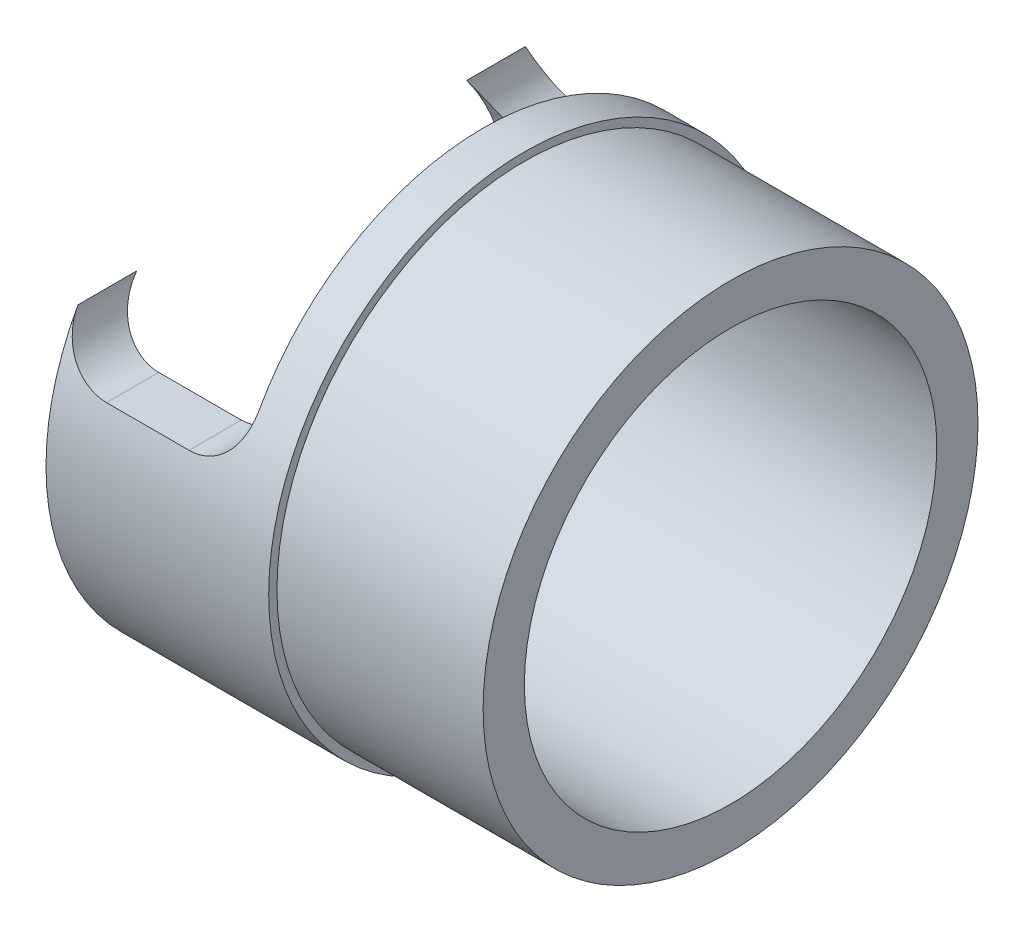
from build123d import *

# Parameters (mm, degrees)
SKETCH3_R               = 31
SKETCH3_R_2             = 25
BOSS_EXTRUDE1_DEPTH     = 22
CUT_EXTRUDE1_DEPTH      = 66.749524713
CUT_EXTRUDE1_DEPTH_BACK = 66.749524713


with BuildPart() as part:
    # Sketch1 → Revolve1 (revolve)
    with BuildSketch(Plane.XY):
        Polygon((49, 25), (19, 25), (19, 31), (24, 31), (24, 30), (49, 30), align=None)
    revolve(axis=Axis((-49, 0, 0), (1, 0, 0)))

    # Sketch3 → Boss-Extrude1 (add)
    with BuildSketch(Plane.ZY.offset(-19)):
        Circle(SKETCH3_R)
        Circle(SKETCH3_R_2, mode=Mode.SUBTRACT)
    extrude(amount=BOSS_EXTRUDE1_DEPTH)

    # Sketch4 → Cut-Extrude1 (cut, two sides: drawn at the far end of the back side and taken through both)
    with BuildSketch(Plane.XY.offset(-CUT_EXTRUDE1_DEPTH_BACK)):
        with BuildLine():
            Line((-3, 31), (19, 31))
            Line((19, 31), (19, 15))
            ThreePointArc((19, 15), (17.242640687, 10.757359313), (13, 9))
            Line((13, 9), (3, 9))
            ThreePointArc((3, 9), (-1.242640687, 10.757359313), (-3, 15))
            Line((-3, 15), (-3, 31))
        make_face()
    extrude(amount=CUT_EXTRUDE1_DEPTH + CUT_EXTRUDE1_DEPTH_BACK, mode=Mode.SUBTRACT)


solid = part.part
